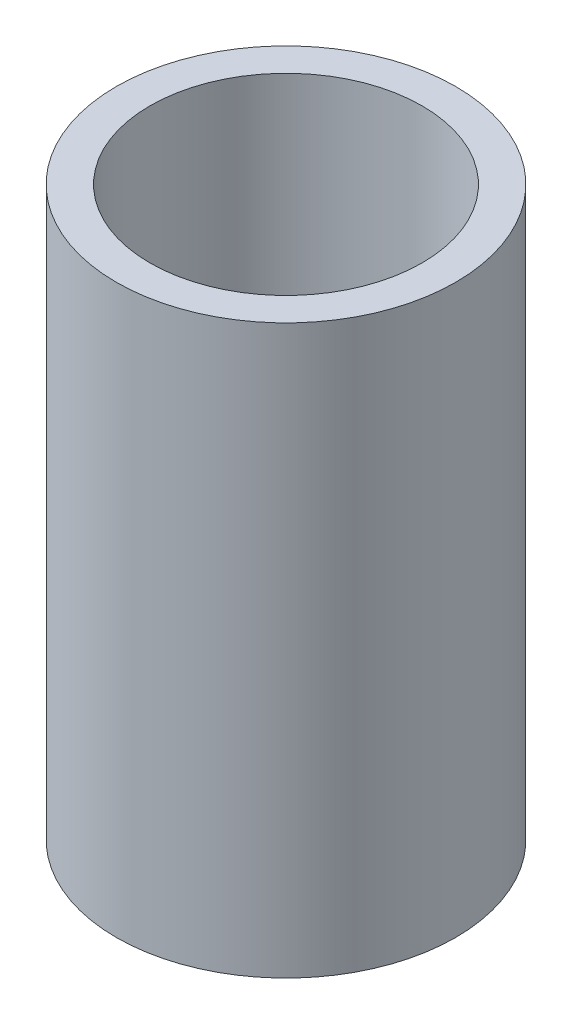
from build123d import *

# Parameters (mm, degrees)
SKETCH1_R           = 17.5
BOSS_EXTRUDE1_DEPTH = 58.53985652
SKETCH2_R           = 14.039953569
CUT_EXTRUDE1_DEPTH  = 64.55639072


with BuildPart() as part:
    # Sketch1 → Boss-Extrude1 (new body)
    with BuildSketch(Plane(origin=(0, 0, 0), x_dir=(1, 0, 0), z_dir=(0, 1, 0))):
        Circle(SKETCH1_R)
    extrude(amount=BOSS_EXTRUDE1_DEPTH)

    # Sketch2 → Cut-Extrude1 (cut, through all)
    with BuildSketch(Plane(origin=(0, 0, 0), x_dir=(1, 0, 0), z_dir=(0, 1, 0))):
        Circle(SKETCH2_R)
    extrude(amount=CUT_EXTRUDE1_DEPTH, mode=Mode.SUBTRACT)


solid = part.part
